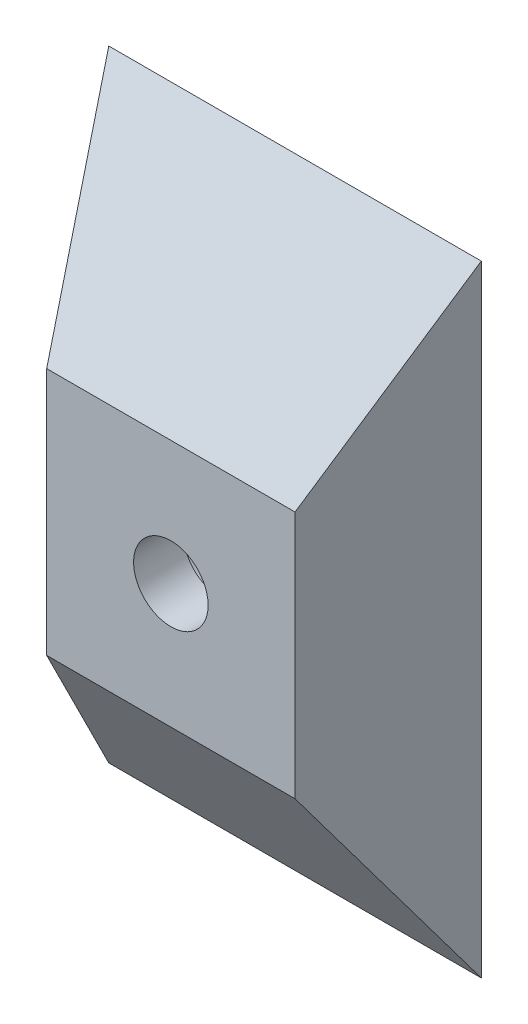
from build123d import *

# Parameters (mm, degrees)
CROQUIS10_R           = 1.5
CORTAR_EXTRUIR1_DEPTH = 5
CROQUIS11_R           = 2.5
CORTAR_EXTRUIR2_DEPTH = 3


with BuildPart() as part:
    # Croquis1 → Recubrir1 section 0
    with BuildSketch(Plane.XY):
        with BuildLine():
            Line((-7.5, -12.5), (7.5, -12.5))
            Line((7.5, -12.5), (7.5, 12.5))
            Line((7.5, 12.5), (-7.5, 12.5))
            Line((-7.5, 12.5), (-7.5, -12.5))
        make_face()
    # Croquis9 → Recubrir1 section 1
    with BuildSketch(Plane.XY.offset(5)):
        with BuildLine():
            Line((-5, 5), (5, 5))
            Line((5, 5), (5, -5))
            Line((5, -5), (-5, -5))
            Line((-5, -5), (-5, 5))
        make_face()
    loft()

    # Croquis10 → Cortar-Extruir1 (cut)
    with BuildSketch(Plane.XY.offset(5)):
        Circle(CROQUIS10_R)
    extrude(amount=-CORTAR_EXTRUIR1_DEPTH, mode=Mode.SUBTRACT)

    # Croquis11 → Cortar-Extruir2 (cut)
    with BuildSketch(Plane(origin=(0, 0, 0), x_dir=(-1, 0, 0), z_dir=(0, 0, -1))):
        Circle(CROQUIS11_R)
    extrude(amount=-CORTAR_EXTRUIR2_DEPTH, mode=Mode.SUBTRACT)


solid = part.part
